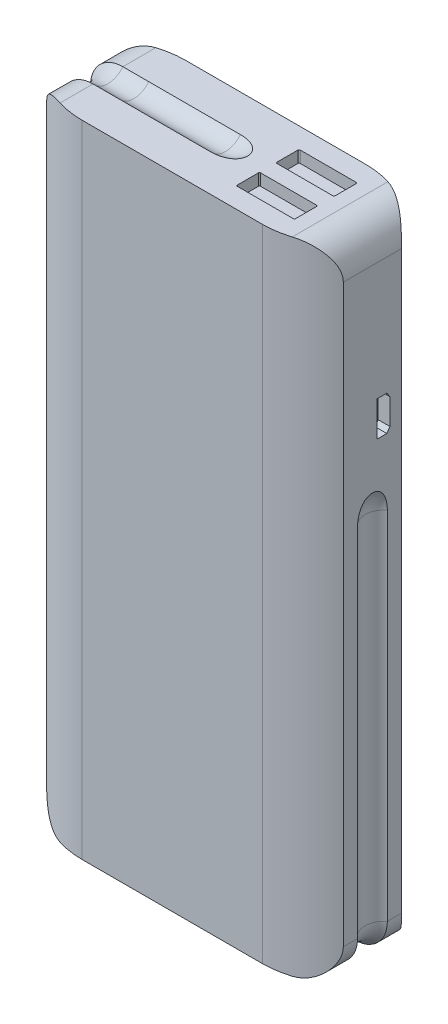
from build123d import *

# Parameters (mm, degrees)
BOSS_EXTRUDE1_DEPTH = 139.7
CUT_EXTRUDE1_DEPTH  = 146.175443726
CUT_EXTRUDE2_DEPTH  = 2.54
SKETCH5_R           = 4.1275
CUT_EXTRUDE3_DEPTH  = 2.54


with BuildPart() as part:
    # Sketch1 → Boss-Extrude1 (new body)
    with BuildSketch(Plane(origin=(0, 0, 0), x_dir=(1, 0, 0), z_dir=(0, 1, 0))):
        with BuildLine():
            ThreePointArc((-32.385, -6.35), (-26.500831002, -10.020938467), (-19.685, -11.303))
            Line((-19.685, -11.303), (19.685, -11.303))
            ThreePointArc((19.685, -11.303), (26.500831002, -10.020938467), (32.385, -6.35))
            Line((32.385, -6.35), (32.385, 6.35))
            ThreePointArc((32.385, 6.35), (26.500831002, 10.020938467), (19.685, 11.303))
            Line((19.685, 11.303), (-19.685, 11.303))
            ThreePointArc((-19.685, 11.303), (-26.500831002, 10.020938467), (-32.385, 6.35))
            Line((-32.385, 6.35), (-32.385, -6.35))
        make_face()
    extrude(amount=BOSS_EXTRUDE1_DEPTH)

    # Sketch2 → Cut-Extrude1 (cut, through all)
    with BuildSketch(Plane.XY.offset(11.303)):
        with BuildLine():
            Line((-32.385, 139.7), (-32.385, 132.6388))
            ThreePointArc((-32.385, 132.6388), (-30.316822403, 137.631822403), (-25.3238, 139.7))
            Line((-25.3238, 139.7), (-32.385, 139.7))
        make_face()
        with BuildLine():
            ThreePointArc((-25.3238, 0), (-30.316822403, 2.068177597), (-32.385, 7.0612))
            Line((-32.385, 7.0612), (-32.385, 0))
            Line((-32.385, 0), (-25.3238, 0))
        make_face()
        with BuildLine():
            Line((32.385, 139.7), (25.3238, 139.7))
            ThreePointArc((25.3238, 139.7), (30.316822403, 137.631822403), (32.385, 132.6388))
            Line((32.385, 132.6388), (32.385, 139.7))
        make_face()
        with BuildLine():
            ThreePointArc((32.385, 7.0612), (30.316822403, 2.068177597), (25.3238, 0))
            Line((25.3238, 0), (32.385, 0))
            Line((32.385, 0), (32.385, 7.0612))
        make_face()
    extrude(amount=-CUT_EXTRUDE1_DEPTH, mode=Mode.SUBTRACT)

    # Sketch4 → Cut-Extrude2 (cut)
    with BuildSketch(Plane(origin=(0, 139.7, 0), x_dir=(1, 0, 0), z_dir=(0, 1, 0))):
        with BuildLine():
            Line((21.971, -6.858), (9.779, -6.858))
            ThreePointArc((9.779, -6.858), (9.599394878, -6.783605122), (9.525, -6.604))
            Line((9.525, -6.604), (9.525, -2.032))
            ThreePointArc((9.525, -2.032), (9.599394878, -1.852394878), (9.779, -1.778))
            Line((9.779, -1.778), (21.971, -1.778))
            ThreePointArc((21.971, -1.778), (22.150605122, -1.852394878), (22.225, -2.032))
            Line((22.225, -2.032), (22.225, -6.604))
            ThreePointArc((22.225, -6.604), (22.150605122, -6.783605122), (21.971, -6.858))
        make_face()
        with BuildLine():
            Line((9.525, 6.604), (9.525, 2.032))
            ThreePointArc((9.525, 2.032), (9.599394878, 1.852394878), (9.779, 1.778))
            Line((9.779, 1.778), (21.971, 1.778))
            ThreePointArc((21.971, 1.778), (22.150605122, 1.852394878), (22.225, 2.032))
            Line((22.225, 2.032), (22.225, 6.604))
            ThreePointArc((22.225, 6.604), (22.150605122, 6.783605122), (21.971, 6.858))
            Line((21.971, 6.858), (9.779, 6.858))
            ThreePointArc((9.779, 6.858), (9.599394878, 6.783605122), (9.525, 6.604))
        make_face()
    extrude(amount=-CUT_EXTRUDE2_DEPTH, mode=Mode.SUBTRACT)

    # Cut-Sweep1: sweep along a path in Sketch3
    with BuildLine(Plane.XY) as cut_sweep1_path:
        Line((43.199496862, 88.9), (39.0525, 88.9))
        ThreePointArc((39.0525, 88.9), (36.133916761, 87.691083239), (34.925, 84.7725))
        Line((34.925, 84.7725), (34.925, 7.0612))
        ThreePointArc((34.925, 7.0612), (32.112873628, 0.272126372), (25.3238, -2.54))
        Line((25.3238, -2.54), (19.685, -2.54))
        Line((19.685, -2.54), (-19.685, -2.54))
        Line((-19.685, -2.54), (-25.3238, -2.54))
        ThreePointArc((-25.3238, -2.54), (-32.112873628, 0.272126372), (-34.925, 7.0612))
        Line((-34.925, 7.0612), (-34.925, 132.6388))
        ThreePointArc((-34.925, 132.6388), (-32.112873628, 139.427873628), (-25.3238, 142.24))
        Line((-25.3238, 142.24), (-19.685, 142.24))
        Line((-19.685, 142.24), (0.3175, 142.24))
        ThreePointArc((0.3175, 142.24), (3.236083239, 143.448916761), (4.445, 146.3675))
        Line((4.445, 146.3675), (4.445, 151.224135856))
    # Sketch5 → Cut-Sweep1 (sweep, cut)
    with BuildSketch(Plane(origin=(43.199496862, 0, 0), x_dir=(0, 0, -1), z_dir=(1, 0, 0))):
        with Locations((0, 88.9)):
            Circle(SKETCH5_R)
    sweep(path=cut_sweep1_path.line, mode=Mode.SUBTRACT)

    # Sketch6 → Cut-Extrude3 (cut)
    with BuildSketch(Plane(origin=(32.385, 0, 0), x_dir=(0, 0, -1), z_dir=(1, 0, 0))):
        Polygon((1.016, 99.30535623), (1.016, 106.92535623), (3.1369, 106.92535623), (3.81, 105.93475623), (3.81, 100.29595623), (3.1369, 99.30535623), align=None)
    extrude(amount=-CUT_EXTRUDE3_DEPTH, mode=Mode.SUBTRACT)


solid = part.part
